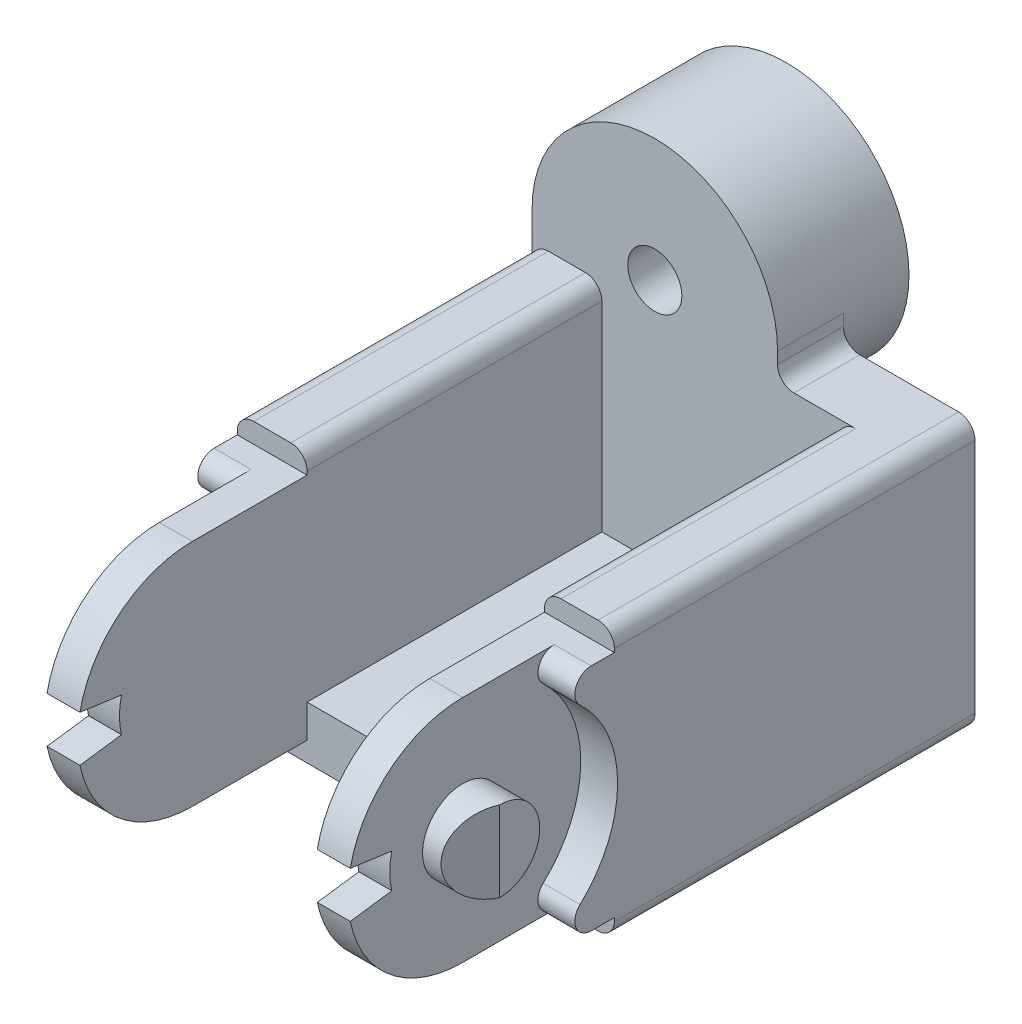
from build123d import *
from build123d.topology import SkipClean

# Parameters (mm, degrees)
SKETCH1_R           = 1.65
BOSS_EXTRUDE1_DEPTH = 40
CUT_EXTRUDE1_START  = -31.98
CUT_EXTRUDE1_DEPTH  = 31.98
SKETCH3_R           = 3.3
CUT_EXTRUDE2_DEPTH  = 4
CUT_EXTRUDE3_DEPTH  = 14
CUT_EXTRUDE4_REACH  = 51.576
SKETCH6_R           = 2.45
CUT_EXTRUDE5_DEPTH  = 2.25
CUT_EXTRUDE6_START  = -20.75
SKETCH6_2_R         = 2.45
CUT_EXTRUDE6_DEPTH  = 2.25
CUT_EXTRUDE7_START  = -9.45
CUT_EXTRUDE7_DEPTH  = 4.9


with BuildPart() as part:
    # Sketch1 → Boss-Extrude1 (new body)
    with BuildSketch(Plane.XY):
        with BuildLine():
            Line((8.48683607, -1.711916105), (14.51316393, -1.711916105))
            ThreePointArc((14.51316393, -1.711916105), (15.220270711, -2.004809324), (15.51316393, -2.711916105))
            Line((15.51316393, -2.711916105), (15.51316393, -17.131916105))
            ThreePointArc((15.51316393, -17.131916105), (15.220270711, -17.839022886), (14.51316393, -18.131916105))
            Line((14.51316393, -18.131916105), (-6.48683607, -18.131916105))
            ThreePointArc((-6.48683607, -18.131916105), (-7.193942851, -17.839022886), (-7.48683607, -17.131916105))
            Line((-7.48683607, -17.131916105), (-7.48683607, 0))
            ThreePointArc((-7.48683607, 0), (0, 7.48683607), (7.48683607, 0))
            Line((7.48683607, 0), (7.48683607, -0.711916105))
            ThreePointArc((7.48683607, -0.711916105), (7.779729289, -1.419022886), (8.48683607, -1.711916105))
        make_face()
        with Locations(Location((0, 0, 0), (0, 0, 180))):
            Circle(SKETCH1_R, mode=Mode.SUBTRACT)
    extrude(amount=BOSS_EXTRUDE1_DEPTH)

    # Sketch2 → Cut-Extrude1 (cut)
    with BuildSketch(Plane.XY.offset(40).offset(CUT_EXTRUDE1_START)):
        with BuildLine():
            Line((-3.22683607, -14.911916105), (-3.22683607, -2.711916105))
            ThreePointArc((-3.22683607, -2.711916105), (-3.519729289, -2.004809324), (-4.22683607, -1.711916105))
            Line((-4.22683607, -1.711916105), (-6.48683607, -1.711916105))
            ThreePointArc((-6.48683607, -1.711916105), (-7.193942851, -2.004809324), (-7.48683607, -2.711916105))
            Line((-7.48683607, -2.711916105), (-7.48683607, 0))
            ThreePointArc((-7.48683607, 0), (0, 7.48683607), (7.48683607, 0))
            Line((7.48683607, 0), (7.48683607, -0.711916105))
            ThreePointArc((7.48683607, -0.711916105), (7.779729289, -1.419022886), (8.48683607, -1.711916105))
            Line((8.48683607, -1.711916105), (12.25316393, -1.711916105))
            ThreePointArc((12.25316393, -1.711916105), (11.546057149, -2.004809324), (11.25316393, -2.711916105))
            Line((11.25316393, -2.711916105), (11.25316393, -14.911916105))
            Line((11.25316393, -14.911916105), (-3.22683607, -14.911916105))
        make_face()
    extrude(amount=CUT_EXTRUDE1_DEPTH, mode=Mode.SUBTRACT)

    # Sketch3 → Cut-Extrude2 (cut)
    with SkipClean():  # the faces are left unmerged after this step: merging them gives an invalid solid
        with BuildSketch(Plane(origin=(0, 0, 0), x_dir=(-1, 0, 0), z_dir=(0, 0, -1))):
            Circle(SKETCH3_R)
            with BuildLine():
                Line((-7.48683607, 0), (-7.48683607, -0.711916105))
                ThreePointArc((-7.48683607, -0.711916105), (-7.779729289, -1.419022886), (-8.48683607, -1.711916105))
                Line((-8.48683607, -1.711916105), (-14.51316393, -1.711916105))
                ThreePointArc((-14.51316393, -1.711916105), (-15.220270711, -2.004809324), (-15.51316393, -2.711916105))
                Line((-15.51316393, -2.711916105), (-15.51316393, -17.131916105))
                ThreePointArc((-15.51316393, -17.131916105), (-15.220270711, -17.839022886), (-14.51316393, -18.131916105))
                Line((-14.51316393, -18.131916105), (6.48683607, -18.131916105))
                ThreePointArc((6.48683607, -18.131916105), (7.193942851, -17.839022886), (7.48683607, -17.131916105))
                Line((7.48683607, -17.131916105), (7.48683607, 0))
                ThreePointArc((7.48683607, 0), (0, -7.48683607), (-7.48683607, 0))
            make_face()
        extrude(amount=-CUT_EXTRUDE2_DEPTH, mode=Mode.SUBTRACT)
    add(part.part.scale(1), mode=Mode.REPLACE)  # the faces are merged on a copy

    # Sketch4 → Cut-Extrude3 (cut)
    with BuildSketch(Plane.XY.offset(40)):
        Polygon((-3.22683607, -16.921916105), (-3.22683607, -2.921916105), (-7.48683607, -2.921916105), (-7.48683607, -1.711916105), (15.51316393, -1.711916105), (15.51316393, -2.921916105), (11.25316393, -2.921916105), (11.25316393, -16.921916105), (15.51316393, -16.921916105), (15.51316393, -18.131916105), (-7.48683607, -18.131916105), (-7.48683607, -16.921916105), align=None)
    extrude(amount=-CUT_EXTRUDE3_DEPTH, mode=Mode.SUBTRACT)

    # Cut-Extrude4: up to this face of the body (flat: up to its plane)
    cut_extrude4_end = Plane(part.part.faces().sort_by_distance((-7.48683607, -9.743748244, 21.544013895))[0])
    # Sketch5 → Cut-Extrude4 (cut, up to the picked face)
    with BuildSketch(Plane(origin=(15.51316393, 0, 0), x_dir=(0, 0, -1), z_dir=(1, 0, 0)), mode=Mode.PRIVATE) as cut_extrude4_sk1:
        with BuildLine():
            Line((-39.85857128, -8.521916105), (-37.324349662, -8.871916105))
            ThreePointArc((-37.324349662, -8.871916105), (-37.45, -9.921916105), (-37.324349662, -10.971916105))
            Line((-37.324349662, -10.971916105), (-39.85857128, -11.321916105))
            ThreePointArc((-39.85857128, -11.321916105), (-37.427188724, -15.34409279), (-33, -16.921916105))
            Line((-33, -16.921916105), (-40, -16.921916105))
            Line((-40, -16.921916105), (-40, -2.921916105))
            Line((-40, -2.921916105), (-33, -2.921916105))
            ThreePointArc((-33, -2.921916105), (-37.427188724, -4.49973942), (-39.85857128, -8.521916105))
        make_face()
    cut_extrude4_tool1 = split(extrude(cut_extrude4_sk1.sketch, amount=-CUT_EXTRUDE4_REACH, mode=Mode.PRIVATE), bisect_by=cut_extrude4_end, keep=Keep.BOTH, mode=Mode.PRIVATE)
    add(cut_extrude4_tool1.solids().sort_by(Axis((15.513164, -9.921916, 38.506526), (-1, 0, 0)))[0], mode=Mode.SUBTRACT)

    # Sketch6 → Cut-Extrude5 (cut)
    with BuildSketch(Plane(origin=(15.51316393, 0, 0), x_dir=(0, 0, -1), z_dir=(1, 0, 0))):
        with BuildLine():
            Line((-27.410724555, -2.921916105), (-31.314770045, -2.921916105))
            ThreePointArc((-31.314770045, -2.921916105), (-40.2, -9.921916105), (-31.314770045, -16.921916105))
            Line((-31.314770045, -16.921916105), (-27.410724555, -16.921916105))
            ThreePointArc((-27.410724555, -16.921916105), (-28.341237133, -16.288176042), (-28.092343512, -15.190208788))
            ThreePointArc((-28.092343512, -15.190208788), (-25.8, -9.921916105), (-28.092343512, -4.653623422))
            ThreePointArc((-28.092343512, -4.653623422), (-28.341237133, -3.555656168), (-27.410724555, -2.921916105))
        make_face()
        with Locations((-33, -9.921916105)):
            Circle(SKETCH6_R, mode=Mode.SUBTRACT)
    extrude(amount=-CUT_EXTRUDE5_DEPTH, mode=Mode.SUBTRACT)

    # Sketch6<2> → Cut-Extrude6 (cut)
    with BuildSketch(Plane(origin=(15.51316393, 0, 0), x_dir=(0, 0, -1), z_dir=(1, 0, 0)).offset(CUT_EXTRUDE6_START)):
        with BuildLine():
            Line((-27.410724555, -2.921916105), (-31.314770045, -2.921916105))
            ThreePointArc((-31.314770045, -2.921916105), (-40.2, -9.921916105), (-31.314770045, -16.921916105))
            Line((-31.314770045, -16.921916105), (-27.410724555, -16.921916105))
            ThreePointArc((-27.410724555, -16.921916105), (-28.341237133, -16.288176042), (-28.092343512, -15.190208788))
            ThreePointArc((-28.092343512, -15.190208788), (-25.8, -9.921916105), (-28.092343512, -4.653623422))
            ThreePointArc((-28.092343512, -4.653623422), (-28.341237133, -3.555656168), (-27.410724555, -2.921916105))
        make_face()
        with Locations((-33, -9.921916105)):
            Circle(SKETCH6_2_R, mode=Mode.SUBTRACT)
    extrude(amount=-CUT_EXTRUDE6_DEPTH, mode=Mode.SUBTRACT)

    # Sketch7 → Cut-Extrude7 (cut)
    with BuildSketch(Plane(origin=(0, -2.921916105, 0), x_dir=(1, 0, 0), z_dir=(0, 1, 0)).offset(CUT_EXTRUDE7_START)):
        Polygon((-7.48683607, -33), (-6.36183607, -35.45), (-7.48683607, -35.45), align=None)
        Polygon((15.51316393, -33), (15.51316393, -35.45), (14.38816393, -35.45), align=None)
    extrude(amount=CUT_EXTRUDE7_DEPTH, mode=Mode.SUBTRACT)


solid = part.part
